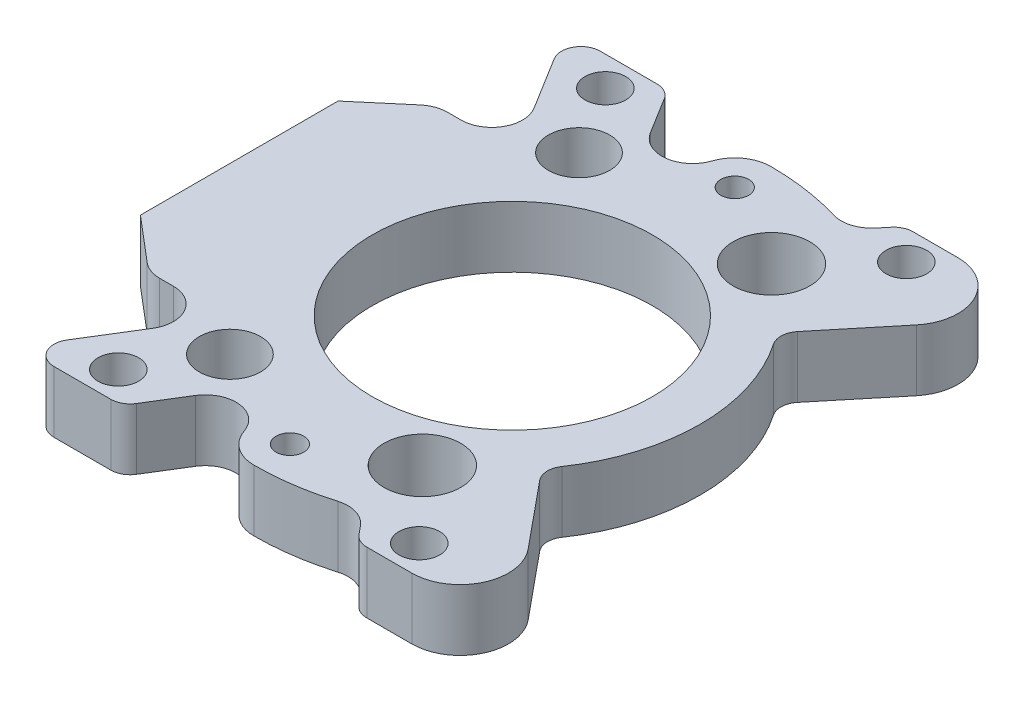
from build123d import *

# Parameters (mm, degrees)
SKETCH1_W           = 56.515
SKETCH1_H           = 56.515
SKETCH1_R           = 2.1082
SKETCH1_R_2         = 14.5
BOSS_EXTRUDE1_DEPTH = 6.35
SKETCH3_R           = 1.435
SKETCH3_R_2         = 3.96875
SKETCH3_R_3         = 3.175
CUT_EXTRUDE1_DEPTH  = 81.176137036
FILLET1_R           = 2


with BuildPart() as part:
    # Sketch1 → Boss-Extrude1 (new body)
    with BuildSketch(Plane(origin=(0, 0, 0), x_dir=(1, 0, 0), z_dir=(0, 1, 0))):
        with Locations((28.2575, 28.2575)):
            Rectangle(SKETCH1_W, SKETCH1_H)
        with Locations((43.8277, 3.0607)):
            Circle(SKETCH1_R, mode=Mode.SUBTRACT)
        with Locations((12.6873, 3.0607)):
            Circle(SKETCH1_R, mode=Mode.SUBTRACT)
        with Locations((12.6873, 53.4543)):
            Circle(SKETCH1_R, mode=Mode.SUBTRACT)
        with Locations((43.8277, 53.4543)):
            Circle(SKETCH1_R, mode=Mode.SUBTRACT)
        with Locations((28.2575, 28.2575)):
            Circle(SKETCH1_R_2, mode=Mode.SUBTRACT)
    extrude(amount=BOSS_EXTRUDE1_DEPTH)

    # Sketch3 → Cut-Extrude1 (cut, through all)
    with BuildSketch(Plane(origin=(0, 6.35, 0), x_dir=(1, 0, 0), z_dir=(0, 1, 0))):
        with BuildLine():
            Line((16.085813501, 0), (40.518749208, 0))
            Line((40.518749208, 0), (39.213305633, 1.585036242))
            ThreePointArc((39.213305633, 1.585036242), (37.691149508, 2.60271564), (35.860147574, 2.610623974))
            ThreePointArc((35.860147574, 2.610623974), (32.098630453, 1.784717433), (28.2575, 1.5075))
            ThreePointArc((28.2575, 1.5075), (26.074260862, 2.211458651), (24.713448522, 4.058153181))
            ThreePointArc((24.713448522, 4.058153181), (22.067676274, 6.203891014), (19.001857165, 4.718948313))
            Line((19.001857165, 4.718948313), (16.085813501, 0))
        make_face()
        with BuildLine():
            ThreePointArc((49.976496805, 8.178709811), (50.638799533, 2.866171171), (46.116988554, 0))
            Line((46.116988554, 0), (56.515, 0))
            Line((56.515, 0), (56.515, 56.515))
            Line((56.515, 56.515), (46.116988554, 56.515))
            ThreePointArc((46.116988554, 56.515), (50.638799533, 53.648828829), (49.976496805, 48.336290189))
            Line((49.976496805, 48.336290189), (44.431541374, 41.603746953))
            ThreePointArc((44.431541374, 41.603746953), (43.977403924, 40.422997575), (44.322647522, 39.20594508))
            ThreePointArc((44.322647522, 39.20594508), (47.698626885, 28.2575), (44.322647522, 17.30905492))
            ThreePointArc((44.322647522, 17.30905492), (43.977403924, 16.092002425), (44.431541374, 14.911253047))
            Line((44.431541374, 14.911253047), (49.976496805, 8.178709811))
        make_face()
        with BuildLine():
            Line((0, 0), (5.506106862, 0))
            Line((5.506106862, 0), (10.776226353, 8.52848048))
            ThreePointArc((10.776226353, 8.52848048), (10.848364266, 11.743703095), (8.0753008, 13.3725))
            Line((8.0753008, 13.3725), (6.662712379, 13.3725))
            ThreePointArc((6.662712379, 13.3725), (5.569380258, 13.566686374), (4.609786847, 14.125492205))
            Line((4.609786847, 14.125492205), (0, 18.032807917))
            Line((0, 18.032807917), (0, 0))
        make_face()
        with BuildLine():
            Line((39.213305633, 54.929963758), (40.518749208, 56.515))
            Line((40.518749208, 56.515), (16.085813501, 56.515))
            Line((16.085813501, 56.515), (19.001857165, 51.796051687))
            ThreePointArc((19.001857165, 51.796051687), (22.067676274, 50.311108986), (24.713448522, 52.456846819))
            ThreePointArc((24.713448522, 52.456846819), (26.074260862, 54.303541349), (28.2575, 55.0075))
            ThreePointArc((28.2575, 55.0075), (32.098630453, 54.730282567), (35.860147574, 53.904376026))
            ThreePointArc((35.860147574, 53.904376026), (37.691149508, 53.91228436), (39.213305633, 54.929963758))
        make_face()
        with BuildLine():
            Line((10.776226353, 47.98651952), (5.506106862, 56.515))
            Line((5.506106862, 56.515), (0, 56.515))
            Line((0, 56.515), (0, 38.482192083))
            Line((0, 38.482192083), (4.609786847, 42.389507795))
            ThreePointArc((4.609786847, 42.389507795), (5.569380258, 42.948313626), (6.662712379, 43.1425))
            Line((6.662712379, 43.1425), (8.0753008, 43.1425))
            ThreePointArc((8.0753008, 43.1425), (10.848364266, 44.771296905), (10.776226353, 47.98651952))
        make_face()
        with Locations((28.2575, 51.27)):
            Circle(SKETCH3_R)
        with Locations((28.2575, 5.245)):
            Circle(SKETCH3_R)
        with Locations((37.008353254, 10.1975)):
            Circle(SKETCH3_R_2)
        with Locations((17.097439516, 10.1975)):
            Circle(SKETCH3_R_3)
        with Locations((17.097439516, 46.3175)):
            Circle(SKETCH3_R_3)
        with Locations((37.008353254, 46.3175)):
            Circle(SKETCH3_R_2)
    extrude(amount=-CUT_EXTRUDE1_DEPTH, mode=Mode.SUBTRACT)

    # Fillet1
    fillet1_edges = [part.edges().sort_by_distance(p)[0] for p in [
        (5.506106862, 3.175, 0),
        (5.506106862, 3.175, -56.515),
        (40.518749208, 3.175, 0),
        (16.085813501, 3.175, 0),
        (16.085813501, 3.175, -56.515),
        (40.518749208, 3.175, -56.515),
    ]]
    fillet(fillet1_edges, radius=FILLET1_R)


solid = part.part
